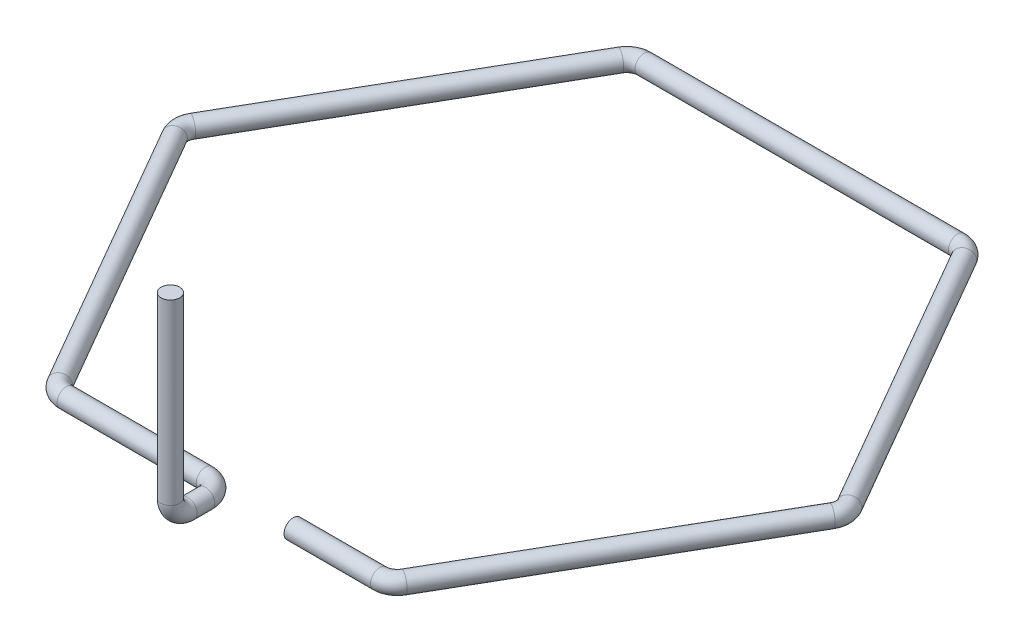
from build123d import *

# Parameters (mm, degrees)
ESBO_O2_R              = 1.585
VARREDURA4_OUTLINE_R   = 1.585
VARREDURA4_ANGLE       = 90
VARREDURA4_START       = -1.5000001
VARREDURA4_2_OUTLINE_R = 1.585
VARREDURA4_2_DEPTH     = 3.0000002
VARREDURA4_START_2     = 2.9999999
VARREDURA4_3_OUTLINE_R = 1.585
VARREDURA4_3_DEPTH     = 30.4000001


with BuildPart() as part:
    # Varredura3: sweep along a path in Esboço1
    with BuildLine(Plane(origin=(0, 0, 0), x_dir=(1, 0, 0), z_dir=(0, 1, 0))) as varredura3_path:
        Line((0, 0), (0, 1.5))
        ThreePointArc((0, 1.5), (-0.878679656, 3.621320344), (-3, 4.5))
        Line((-3, 4.5), (-26.767949192, 4.5))
        ThreePointArc((-26.767949192, 4.5), (-28.267949192, 4.901923789), (-29.366025404, 6))
        Line((-29.366025404, 6), (-56.133974596, 52.363448016))
        ThreePointArc((-56.133974596, 52.363448016), (-56.535898385, 53.863448016), (-56.133974596, 55.363448016))
        Line((-56.133974596, 55.363448016), (-29.366025404, 101.726896031))
        ThreePointArc((-29.366025404, 101.726896031), (-28.267949192, 102.824972243), (-26.767949192, 103.226896031))
        Line((-26.767949192, 103.226896031), (26.767949192, 103.226896031))
        ThreePointArc((26.767949192, 103.226896031), (28.267949192, 102.824972243), (29.366025404, 101.726896031))
        Line((29.366025404, 101.726896031), (56.133974596, 55.363448016))
        ThreePointArc((56.133974596, 55.363448016), (56.535898385, 53.863448016), (56.133974596, 52.363448016))
        Line((56.133974596, 52.363448016), (29.366025404, 6))
        ThreePointArc((29.366025404, 6), (28.267949192, 4.901923789), (26.767949192, 4.5))
        Line((26.767949192, 4.5), (12, 4.5))
    # Esboço2 → Varredura3 (sweep)
    with BuildSketch(Plane.XY):
        Circle(ESBO_O2_R)
    sweep(path=varredura3_path.line)



with BuildPart() as body_2:
    # Varredura4: read off the stored shape, not the designer's step
    # Varredura4 outline → Varredura4 (revolve)
    with BuildSketch(Plane(origin=(0, 3, 1.5), x_dir=(0, 0, 1), z_dir=(0, 1, 0))):
        with Locations((3, 0)):
            Circle(VARREDURA4_OUTLINE_R)
    revolve(axis=Axis((0, 3, 1.5), (1, 0, 0)), revolution_arc=VARREDURA4_ANGLE)


with BuildPart() as part_1:
    add(part.part)

    add(body_2.part)  # Varredura4 2 merges body 2
    # Varredura4 2 outline → Varredura4 2 (add)
    with BuildSketch(Plane.XY.offset(VARREDURA4_START)):
        Circle(VARREDURA4_2_OUTLINE_R)
    extrude(amount=VARREDURA4_2_DEPTH)

    # Varredura4 3 outline → Varredura4 3 (add)
    with BuildSketch(Plane(origin=(0, 0, 0), x_dir=(1, 0, 0), z_dir=(0, 1, 0)).offset(VARREDURA4_START_2)):
        with Locations((0, -4.5)):
            Circle(VARREDURA4_3_OUTLINE_R)
    extrude(amount=VARREDURA4_3_DEPTH)


solid = part_1.part
